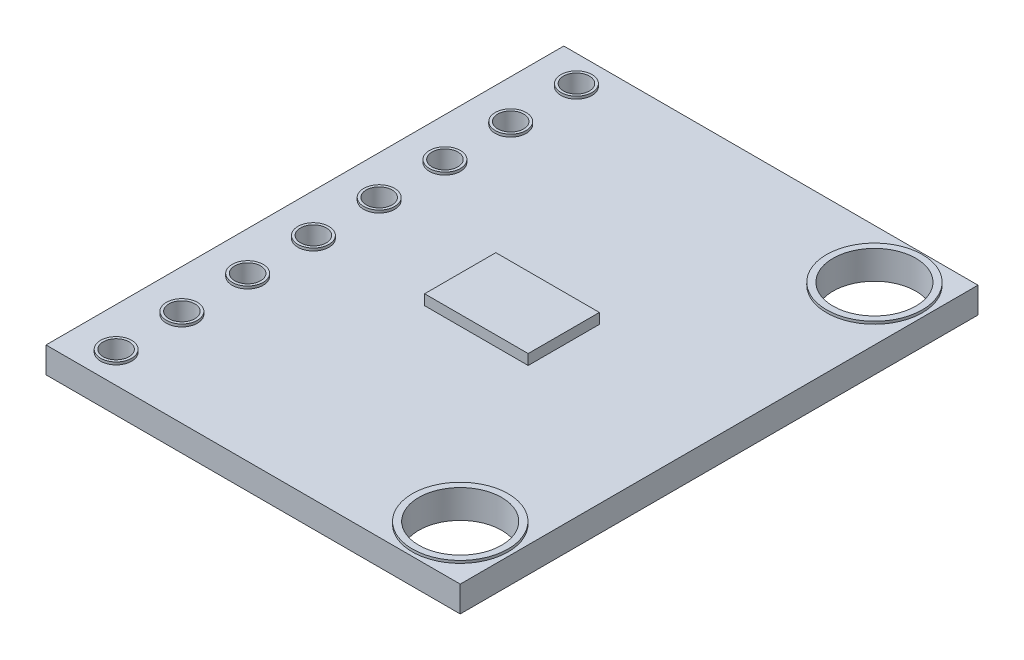
from build123d import *

# Parameters (mm, degrees)
SKETCH1_W                   = 16
SKETCH1_H                   = 20
BOSS_EXTRUDE1_DEPTH         = 1
SKETCH4_W                   = 4
SKETCH4_H                   = 2.75
BOSS_EXTRUDE3_DEPTH         = 0.4
IZIM1_R                     = 0.6
IZIM1_R_2                   = 0.5
Y_KSEKLIK_EKSTR_ZYON1_DEPTH = 0.1
KES_EKSTR_ZYON2_START       = -20.1
IZIM3_R                     = 0.5
KES_EKSTR_ZYON2_DEPTH       = 20.1
IZIM4_R                     = 1.85
IZIM4_R_2                   = 1.6
Y_KSEKLIK_EKSTR_ZYON2_DEPTH = 0.1
KES_EKSTR_ZYON3_START       = -10.1
IZIM5_R                     = 1.6
KES_EKSTR_ZYON3_DEPTH       = 10.1


with BuildPart() as part:
    # Sketch1 → Boss-Extrude1 (new body)
    with BuildSketch(Plane(origin=(0, 0, 0), x_dir=(1, 0, 0), z_dir=(0, 1, 0))):
        Rectangle(SKETCH1_W, SKETCH1_H)
    extrude(amount=BOSS_EXTRUDE1_DEPTH)

    # Çizim1 → Yükseklik-Ekstrüzyon1 (add)
    # profile 1 of 8: a face of its own
    with BuildSketch(Plane(origin=(0, 1, 0), x_dir=(1, 0, 0), z_dir=(0, 1, 0))):
        with Locations((-6.400785843, -8.89)):
            Circle(IZIM1_R)
        with Locations((-6.400785843, -8.89)):
            Circle(IZIM1_R_2, mode=Mode.SUBTRACT)
    # profile 2 of 8: a face of its own
    with BuildSketch(Plane(origin=(0, 1, 0), x_dir=(1, 0, 0), z_dir=(0, 1, 0))):
        with Locations((-6.400785843, -6.35)):
            Circle(IZIM1_R)
        with Locations((-6.400785843, -6.35)):
            Circle(IZIM1_R_2, mode=Mode.SUBTRACT)
    # profile 3 of 8: a face of its own
    with BuildSketch(Plane(origin=(0, 1, 0), x_dir=(1, 0, 0), z_dir=(0, 1, 0))):
        with Locations((-6.400785843, -3.81)):
            Circle(IZIM1_R)
        with Locations((-6.400785843, -3.81)):
            Circle(IZIM1_R_2, mode=Mode.SUBTRACT)
    # profile 4 of 8: a face of its own
    with BuildSketch(Plane(origin=(0, 1, 0), x_dir=(1, 0, 0), z_dir=(0, 1, 0))):
        with Locations((-6.400785843, -1.27)):
            Circle(IZIM1_R)
        with Locations((-6.400785843, -1.27)):
            Circle(IZIM1_R_2, mode=Mode.SUBTRACT)
    # profile 5 of 8: a face of its own
    with BuildSketch(Plane(origin=(0, 1, 0), x_dir=(1, 0, 0), z_dir=(0, 1, 0))):
        with Locations((-6.400785843, 1.27)):
            Circle(IZIM1_R)
        with Locations((-6.400785843, 1.27)):
            Circle(IZIM1_R_2, mode=Mode.SUBTRACT)
    # profile 6 of 8: a face of its own
    with BuildSketch(Plane(origin=(0, 1, 0), x_dir=(1, 0, 0), z_dir=(0, 1, 0))):
        with Locations((-6.400785843, 3.81)):
            Circle(IZIM1_R)
        with Locations((-6.400785843, 3.81)):
            Circle(IZIM1_R_2, mode=Mode.SUBTRACT)
    # profile 7 of 8: a face of its own
    with BuildSketch(Plane(origin=(0, 1, 0), x_dir=(1, 0, 0), z_dir=(0, 1, 0))):
        with Locations((-6.400785843, 6.35)):
            Circle(IZIM1_R)
        with Locations((-6.400785843, 6.35)):
            Circle(IZIM1_R_2, mode=Mode.SUBTRACT)
    # profile 8 of 8: a face of its own
    with BuildSketch(Plane(origin=(0, 1, 0), x_dir=(1, 0, 0), z_dir=(0, 1, 0))):
        with Locations((-6.400785843, 8.89)):
            Circle(IZIM1_R)
        with Locations((-6.400785843, 8.89)):
            Circle(IZIM1_R_2, mode=Mode.SUBTRACT)
    extrude(amount=Y_KSEKLIK_EKSTR_ZYON1_DEPTH)

    # Çizim3 → Kes-Ekstrüzyon2 (cut)
    with BuildSketch(Plane(origin=(0, 1, 0), x_dir=(1, 0, 0), z_dir=(0, 1, 0)).offset(KES_EKSTR_ZYON2_START)):
        with Locations((-6.400785843, -8.89)):
            Circle(IZIM3_R)
        with Locations((-6.400785843, -6.35)):
            Circle(IZIM3_R)
        with Locations((-6.400785843, -3.81)):
            Circle(IZIM3_R)
        with Locations((-6.400785843, -1.27)):
            Circle(IZIM3_R)
        with Locations((-6.400785843, 1.27)):
            Circle(IZIM3_R)
        with Locations((-6.400785843, 3.81)):
            Circle(IZIM3_R)
        with Locations((-6.400785843, 6.35)):
            Circle(IZIM3_R)
        with Locations((-6.400785843, 8.89)):
            Circle(IZIM3_R)
    extrude(amount=KES_EKSTR_ZYON2_DEPTH, mode=Mode.SUBTRACT)

    # Çizim4 → Yükseklik-Ekstrüzyon2 (add)
    # profile 1 of 2: a face of its own
    with BuildSketch(Plane(origin=(0, 1, 0), x_dir=(1, 0, 0), z_dir=(0, 1, 0))):
        with Locations((6, -8)):
            Circle(IZIM4_R)
        with Locations((6, -8)):
            Circle(IZIM4_R_2, mode=Mode.SUBTRACT)
    # profile 2 of 2: a face of its own
    with BuildSketch(Plane(origin=(0, 1, 0), x_dir=(1, 0, 0), z_dir=(0, 1, 0))):
        with Locations((6, 8)):
            Circle(IZIM4_R)
        with Locations((6, 8)):
            Circle(IZIM4_R_2, mode=Mode.SUBTRACT)
    extrude(amount=Y_KSEKLIK_EKSTR_ZYON2_DEPTH)

    # Çizim5 → Kes-Ekstrüzyon3 (cut)
    with BuildSketch(Plane(origin=(0, 1, 0), x_dir=(1, 0, 0), z_dir=(0, 1, 0)).offset(KES_EKSTR_ZYON3_START)):
        with Locations((6, 8)):
            Circle(IZIM5_R)
        with Locations((6, -8)):
            Circle(IZIM5_R)
    extrude(amount=KES_EKSTR_ZYON3_DEPTH, mode=Mode.SUBTRACT)


with BuildPart() as body_2:
    # Sketch4 → Boss-Extrude3 (new body)
    with BuildSketch(Plane(origin=(0, 1, 0), x_dir=(1, 0, 0), z_dir=(0, 1, 0))):
        Rectangle(SKETCH4_W, SKETCH4_H)
    extrude(amount=BOSS_EXTRUDE3_DEPTH)


solid = Compound([part.part, body_2.part])
